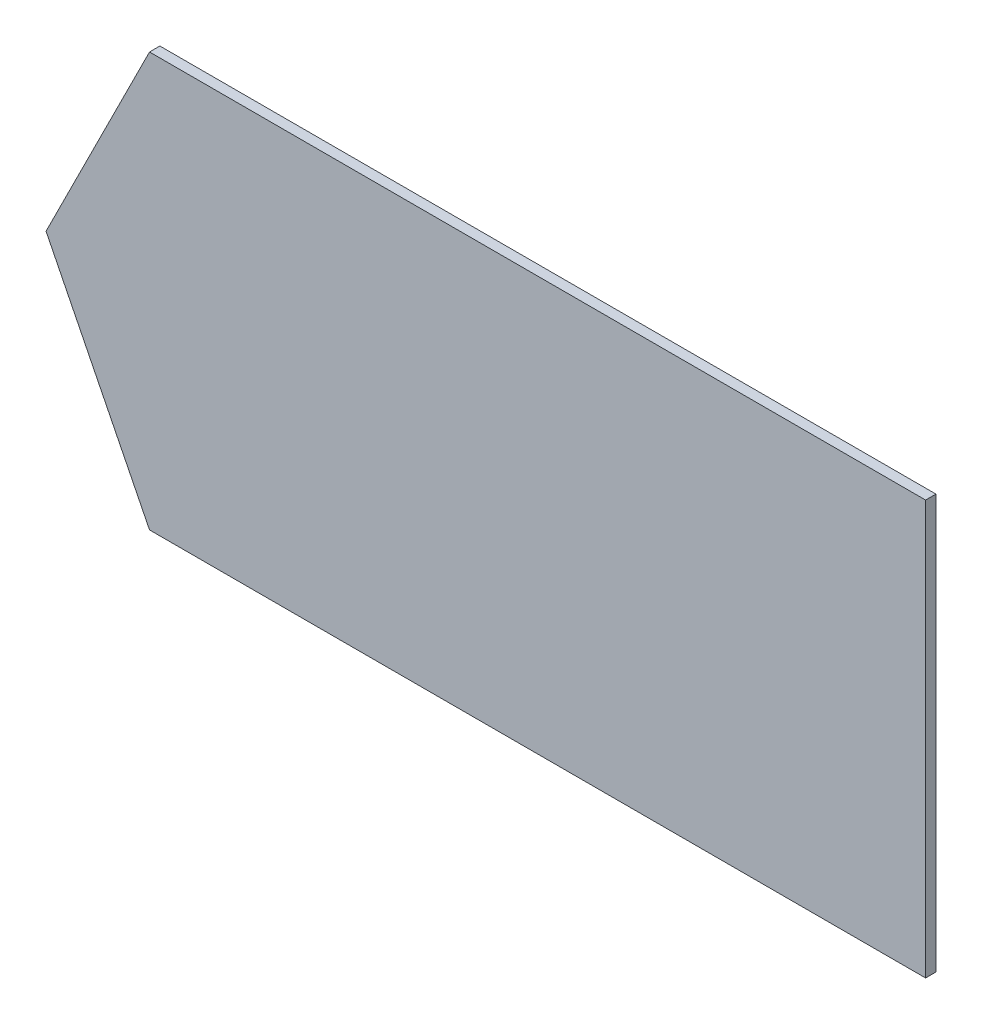
from build123d import *

# Parameters (mm, degrees)
EXTRUDE_2_DEPTH = 1


with BuildPart() as part:
    # 草图2 → 凸台-拉伸2 (new, symmetric)
    with BuildSketch(Plane.XY):
        Polygon((-75, 40), (75, 40), (75, -40), (-75, -40), (-95, 0), align=None)
    extrude(amount=EXTRUDE_2_DEPTH, both=True)


solid = part.part
